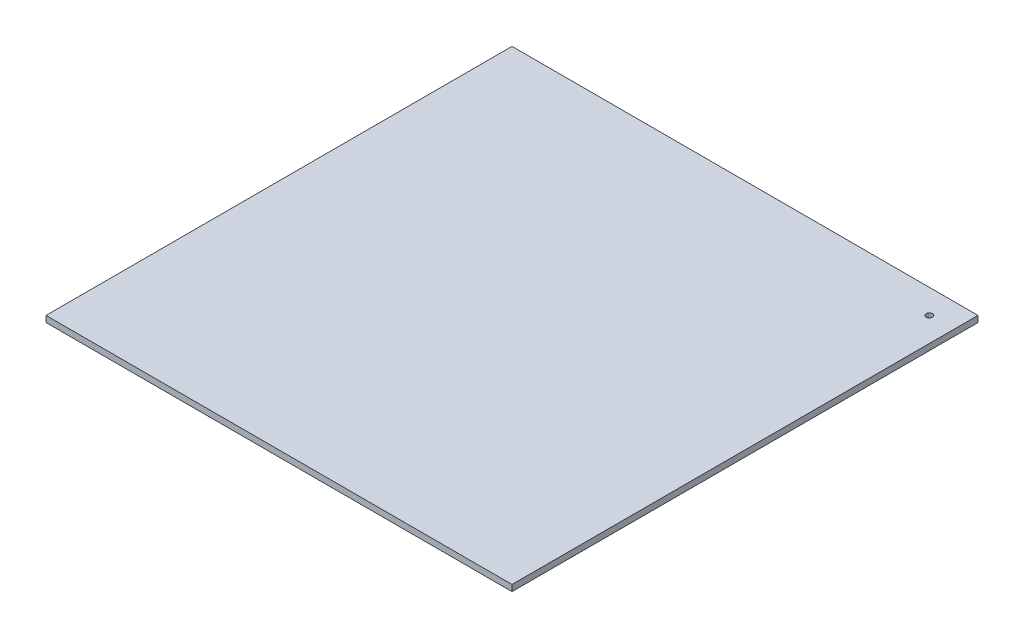
from build123d import *

# Parameters (mm, degrees)
SKETCH1_W           = 300
SKETCH1_H           = 300
SKETCH1_R           = 2
BOSS_EXTRUDE1_DEPTH = 4


with BuildPart() as part:
    # Sketch1 → Boss-Extrude1 (new body)
    with BuildSketch(Plane(origin=(0, 0, 0), x_dir=(1, 0, 0), z_dir=(0, 1, 0))):
        with Locations((99.361311032, 179.396157836)):
            Rectangle(SKETCH1_W, SKETCH1_H)
        with Locations((233.711599457, 313.746446261)):
            Circle(SKETCH1_R, mode=Mode.SUBTRACT)
    extrude(amount=BOSS_EXTRUDE1_DEPTH)


solid = part.part
